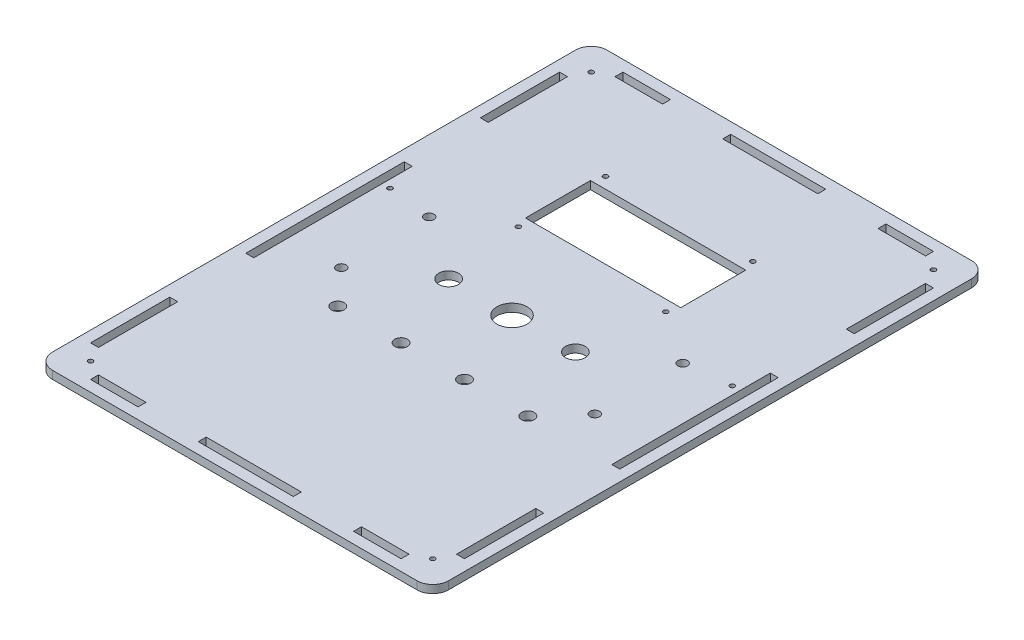
from build123d import *

# Parameters (mm, degrees)
SKETCH1_R           = 1.5
SKETCH1_W           = 30
SKETCH1_H           = 5
SKETCH1_W_2         = 5
SKETCH1_H_2         = 50
SKETCH1_R_2         = 3
SKETCH1_R_3         = 4
SKETCH1_W_3         = 60
SKETCH1_R_4         = 6.2
SKETCH1_R_5         = 9.5
SKETCH1_W_4         = 98
SKETCH1_H_3         = 41
SKETCH1_H_4         = 100
BOSS_EXTRUDE1_DEPTH = 5


with BuildPart() as part:
    # Sketch1 → Boss-Extrude1 (new body)
    # profile 1 of 2: a face of its own
    with BuildSketch(Plane(origin=(0, 0, 0), x_dir=(1, 0, 0), z_dir=(0, 1, 0))):
        with BuildLine():
            ThreePointArc((0, 10), (2.928932188, 2.928932188), (10, 0))
            Line((10, 0), (240, 0))
            ThreePointArc((240, 0), (247.071067812, 2.928932188), (250, 10))
            Line((250, 10), (250, 340))
            ThreePointArc((250, 340), (247.071067812, 347.071067812), (240, 350))
            Line((240, 350), (10, 350))
            ThreePointArc((10, 350), (2.928932188, 347.071067812), (0, 340))
            Line((0, 340), (0, 10))
        make_face()
        with Locations((17, 17)):
            Circle(SKETCH1_R, mode=Mode.SUBTRACT)
        with Locations((42, 9.5)):
            Rectangle(SKETCH1_W, SKETCH1_H, mode=Mode.SUBTRACT)
        with Locations((9.5, 52)):
            Rectangle(SKETCH1_W_2, SKETCH1_H_2, mode=Mode.SUBTRACT)
        with Locations((45, 147.266112644)):
            Circle(SKETCH1_R_2, mode=Mode.SUBTRACT)
        with Locations((65, 125)):
            Circle(SKETCH1_R_3, mode=Mode.SUBTRACT)
        with Locations((105, 125)):
            Circle(SKETCH1_R_3, mode=Mode.SUBTRACT)
        with Locations((125, 9.5)):
            Rectangle(SKETCH1_W_3, SKETCH1_H, mode=Mode.SUBTRACT)
        with Locations((208, 9.5)):
            Rectangle(SKETCH1_W, SKETCH1_H, mode=Mode.SUBTRACT)
        with Locations((233, 17)):
            Circle(SKETCH1_R, mode=Mode.SUBTRACT)
        with Locations((240.5, 52)):
            Rectangle(SKETCH1_W_2, SKETCH1_H_2, mode=Mode.SUBTRACT)
        with Locations((145, 125)):
            Circle(SKETCH1_R_3, mode=Mode.SUBTRACT)
        with Locations((185, 125)):
            Circle(SKETCH1_R_3, mode=Mode.SUBTRACT)
        with Locations((205, 147.266112644)):
            Circle(SKETCH1_R_2, mode=Mode.SUBTRACT)
        Polygon((7, 175), (7, 225), (12, 225), (12, 125), (7, 125), align=None, mode=Mode.SUBTRACT)
        with Locations((17, 206)):
            Circle(SKETCH1_R, mode=Mode.SUBTRACT)
        with Locations((45, 202.733887356)):
            Circle(SKETCH1_R_2, mode=Mode.SUBTRACT)
        with Locations((85, 175)):
            Circle(SKETCH1_R_4, mode=Mode.SUBTRACT)
        with Locations((78.5, 225.5)):
            Circle(SKETCH1_R, mode=Mode.SUBTRACT)
        with Locations((9.5, 298)):
            Rectangle(SKETCH1_W_2, SKETCH1_H_2, mode=Mode.SUBTRACT)
        with Locations((17, 333)):
            Circle(SKETCH1_R, mode=Mode.SUBTRACT)
        with Locations((42, 340.5)):
            Rectangle(SKETCH1_W, SKETCH1_H, mode=Mode.SUBTRACT)
        with Locations((78.5, 280.5)):
            Circle(SKETCH1_R, mode=Mode.SUBTRACT)
        with Locations((125, 175)):
            Circle(SKETCH1_R_5, mode=Mode.SUBTRACT)
        with Locations((165, 175)):
            Circle(SKETCH1_R_4, mode=Mode.SUBTRACT)
        with Locations((125, 253)):
            Rectangle(SKETCH1_W_4, SKETCH1_H_3, mode=Mode.SUBTRACT)
        with Locations((171.5, 225.5)):
            Circle(SKETCH1_R, mode=Mode.SUBTRACT)
        with Locations((205, 202.733887356)):
            Circle(SKETCH1_R_2, mode=Mode.SUBTRACT)
        with Locations((240.5, 175)):
            Rectangle(SKETCH1_W_2, SKETCH1_H_4, mode=Mode.SUBTRACT)
        with Locations((233, 206)):
            Circle(SKETCH1_R, mode=Mode.SUBTRACT)
        with Locations((171.5, 280.5)):
            Circle(SKETCH1_R, mode=Mode.SUBTRACT)
        Polygon((95, 343), (125, 343), (155, 343), (155, 338), (95, 338), align=None, mode=Mode.SUBTRACT)
        with Locations((240.5, 298)):
            Rectangle(SKETCH1_W_2, SKETCH1_H_2, mode=Mode.SUBTRACT)
        with Locations((208, 340.5)):
            Rectangle(SKETCH1_W, SKETCH1_H, mode=Mode.SUBTRACT)
        with Locations((233, 333)):
            Circle(SKETCH1_R, mode=Mode.SUBTRACT)
    # profile 2 of 2: a face of its own
    with BuildSketch(Plane(origin=(0, 0, 0), x_dir=(1, 0, 0), z_dir=(0, 1, 0))):
        with BuildLine():
            ThreePointArc((0, 10), (2.928932188, 2.928932188), (10, 0))
            Line((10, 0), (240, 0))
            ThreePointArc((240, 0), (247.071067812, 2.928932188), (250, 10))
            Line((250, 10), (250, 340))
            ThreePointArc((250, 340), (247.071067812, 347.071067812), (240, 350))
            Line((240, 350), (10, 350))
            ThreePointArc((10, 350), (2.928932188, 347.071067812), (0, 340))
            Line((0, 340), (0, 10))
        make_face()
        with Locations((17, 17)):
            Circle(SKETCH1_R, mode=Mode.SUBTRACT)
        with Locations((42, 9.5)):
            Rectangle(SKETCH1_W, SKETCH1_H, mode=Mode.SUBTRACT)
        with Locations((9.5, 52)):
            Rectangle(SKETCH1_W_2, SKETCH1_H_2, mode=Mode.SUBTRACT)
        with Locations((45, 147.266112644)):
            Circle(SKETCH1_R_2, mode=Mode.SUBTRACT)
        with Locations((65, 125)):
            Circle(SKETCH1_R_3, mode=Mode.SUBTRACT)
        with Locations((105, 125)):
            Circle(SKETCH1_R_3, mode=Mode.SUBTRACT)
        with Locations((125, 9.5)):
            Rectangle(SKETCH1_W_3, SKETCH1_H, mode=Mode.SUBTRACT)
        with Locations((208, 9.5)):
            Rectangle(SKETCH1_W, SKETCH1_H, mode=Mode.SUBTRACT)
        with Locations((233, 17)):
            Circle(SKETCH1_R, mode=Mode.SUBTRACT)
        with Locations((240.5, 52)):
            Rectangle(SKETCH1_W_2, SKETCH1_H_2, mode=Mode.SUBTRACT)
        with Locations((145, 125)):
            Circle(SKETCH1_R_3, mode=Mode.SUBTRACT)
        with Locations((185, 125)):
            Circle(SKETCH1_R_3, mode=Mode.SUBTRACT)
        with Locations((205, 147.266112644)):
            Circle(SKETCH1_R_2, mode=Mode.SUBTRACT)
        Polygon((7, 175), (7, 225), (12, 225), (12, 125), (7, 125), align=None, mode=Mode.SUBTRACT)
        with Locations((17, 206)):
            Circle(SKETCH1_R, mode=Mode.SUBTRACT)
        with Locations((45, 202.733887356)):
            Circle(SKETCH1_R_2, mode=Mode.SUBTRACT)
        with Locations((85, 175)):
            Circle(SKETCH1_R_4, mode=Mode.SUBTRACT)
        with Locations((78.5, 225.5)):
            Circle(SKETCH1_R, mode=Mode.SUBTRACT)
        with Locations((9.5, 298)):
            Rectangle(SKETCH1_W_2, SKETCH1_H_2, mode=Mode.SUBTRACT)
        with Locations((17, 333)):
            Circle(SKETCH1_R, mode=Mode.SUBTRACT)
        with Locations((42, 340.5)):
            Rectangle(SKETCH1_W, SKETCH1_H, mode=Mode.SUBTRACT)
        with Locations((78.5, 280.5)):
            Circle(SKETCH1_R, mode=Mode.SUBTRACT)
        with Locations((125, 175)):
            Circle(SKETCH1_R_5, mode=Mode.SUBTRACT)
        with Locations((165, 175)):
            Circle(SKETCH1_R_4, mode=Mode.SUBTRACT)
        with Locations((125, 253)):
            Rectangle(SKETCH1_W_4, SKETCH1_H_3, mode=Mode.SUBTRACT)
        with Locations((171.5, 225.5)):
            Circle(SKETCH1_R, mode=Mode.SUBTRACT)
        with Locations((205, 202.733887356)):
            Circle(SKETCH1_R_2, mode=Mode.SUBTRACT)
        with Locations((240.5, 175)):
            Rectangle(SKETCH1_W_2, SKETCH1_H_4, mode=Mode.SUBTRACT)
        with Locations((233, 206)):
            Circle(SKETCH1_R, mode=Mode.SUBTRACT)
        with Locations((171.5, 280.5)):
            Circle(SKETCH1_R, mode=Mode.SUBTRACT)
        Polygon((95, 343), (125, 343), (155, 343), (155, 338), (95, 338), align=None, mode=Mode.SUBTRACT)
        with Locations((240.5, 298)):
            Rectangle(SKETCH1_W_2, SKETCH1_H_2, mode=Mode.SUBTRACT)
        with Locations((208, 340.5)):
            Rectangle(SKETCH1_W, SKETCH1_H, mode=Mode.SUBTRACT)
        with Locations((233, 333)):
            Circle(SKETCH1_R, mode=Mode.SUBTRACT)
    extrude(amount=BOSS_EXTRUDE1_DEPTH)


solid = part.part
